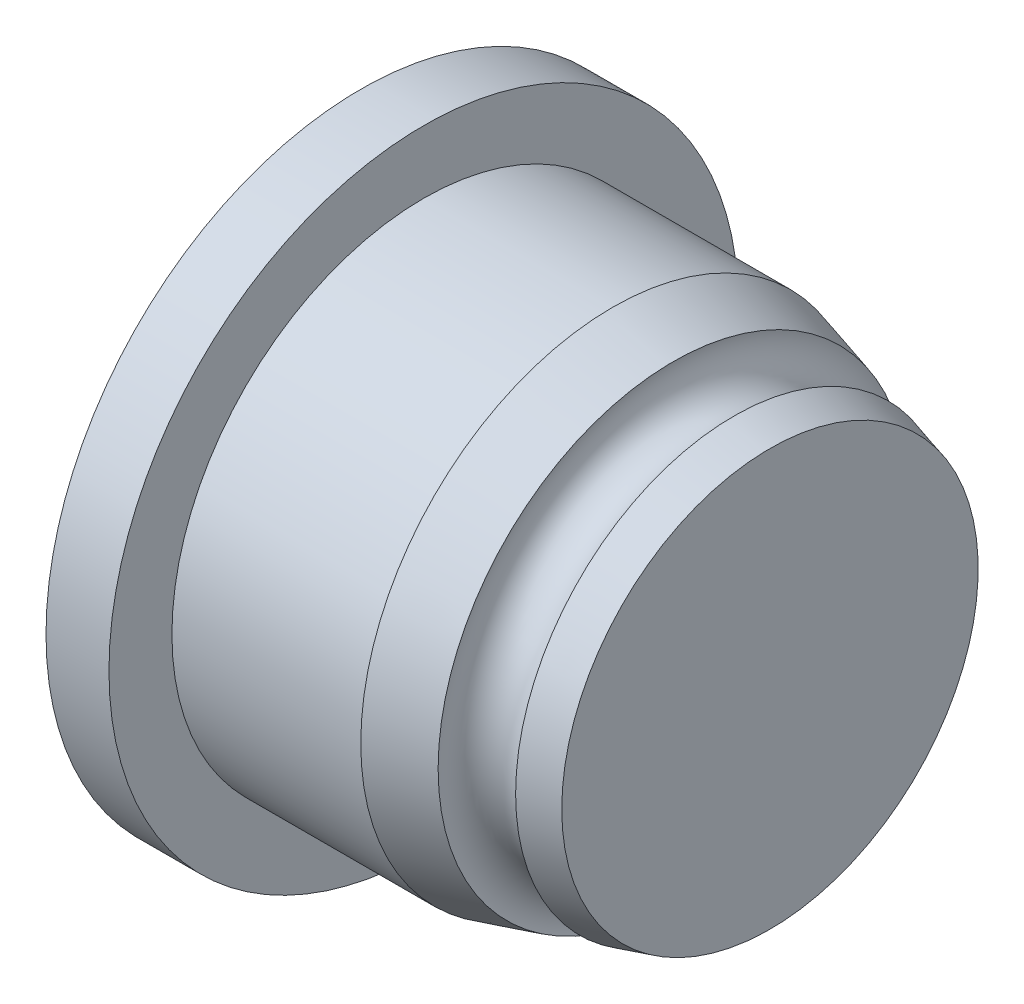
from build123d import *

# Parameters (mm, degrees)
SKETCH3_R               = 1.75
BOSS_EXTRUDE1_DEPTH     = 4
CUT_EXTRUDE1_DEPTH      = 10.604686356
CUT_EXTRUDE1_DEPTH_BACK = 5
SKETCH4_R               = 2.4


with BuildPart() as part:
    # Sketch2 → Revolve1 (revolve)
    with BuildSketch(Plane(origin=(0, 0, 0), x_dir=(1, 0, 0), z_dir=(0, 1, 0))):
        with BuildLine():
            Line((0, 0), (0, 5))
            Line((0, 5), (1, 5))
            Line((1, 5), (1, 4))
            Line((1, 4), (4, 4))
            Line((4, 4), (4.962239732, 3.733469404))
            ThreePointArc((4.962239732, 3.733469404), (5.310627067, 3.11814326), (5.925953212, 3.466530596))
            Line((5.925953212, 3.466530596), (6.5, 3.307525488))
            Line((6.5, 3.307525488), (6.5, 0))
            Line((6.5, 0), (0, 0))
        make_face()
    revolve(axis=Axis((0, 0, 0), (1, 0, 0)))

    # Sketch3 → Boss-Extrude1 (add)
    with BuildSketch(Plane.ZY):
        Circle(SKETCH3_R)
    extrude(amount=-BOSS_EXTRUDE1_DEPTH)

    # Sketch4 → Cut-Extrude1 (cut, two sides: drawn at the far end of the back side and taken through both)
    with BuildSketch(Plane.ZY.offset(-CUT_EXTRUDE1_DEPTH_BACK)):
        Circle(SKETCH4_R)
    extrude(amount=CUT_EXTRUDE1_DEPTH + CUT_EXTRUDE1_DEPTH_BACK, mode=Mode.SUBTRACT)


solid = part.part
